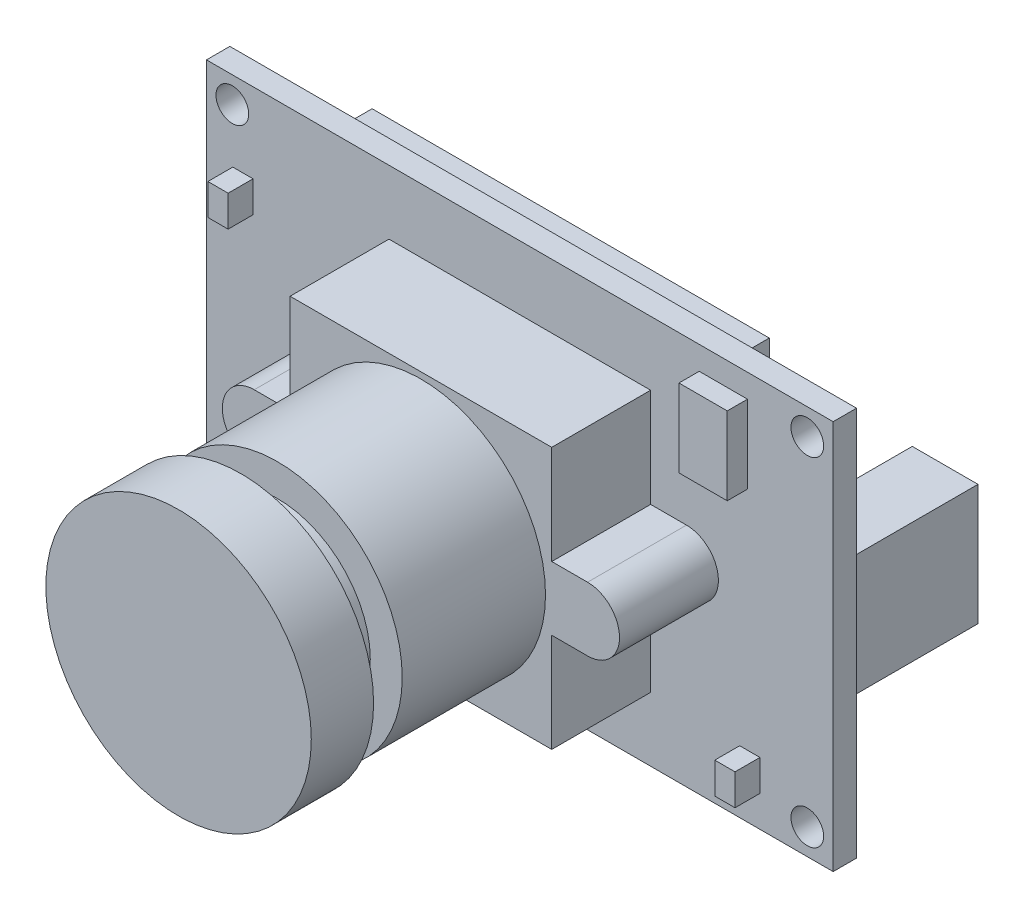
from build123d import *

# Parameters (mm, degrees)
SKETCH2_W            = 40.2336
SKETCH2_H            = 25.019
SKETCH2_R            = 1.05
BOSS_EXTRUDE1_DEPTH  = 1.5
BOSS_EXTRUDE2_DEPTH  = 6.35
SKETCH4_R            = 8
BOSS_EXTRUDE3_DEPTH  = 9.2
SKETCH5_R            = 5.95
BOSS_EXTRUDE4_DEPTH  = 2.36
SKETCH6_R            = 8.5217
LENS_DEPTH           = 4
SKETCH7_W            = 4.22
SKETCH7_H            = 7.75
BOSS_EXTRUDE6_DEPTH  = 8.3
SKETCH8_W            = 9
SKETCH8_H            = 2.985879982
BOSS_EXTRUDE7_DEPTH  = 4.35
SKETCH9_W            = 3.1
SKETCH9_H            = 5
BOSS_EXTRUDE8_DEPTH  = 1.3
SKETCH10_W           = 25.5
SKETCH10_H           = 8
BOSS_EXTRUDE9_DEPTH  = 1.4
SKETCH11_W           = 1.3
SKETCH11_H           = 2
BOSS_EXTRUDE10_DEPTH = 1.6
SKETCH12_W           = 3
SKETCH12_H           = 3
BOSS_EXTRUDE11_DEPTH = 1.4
SKETCH13_W           = 3.175
SKETCH13_H           = 2.6162
SKETCH13_W_2         = 8.509
SKETCH13_H_2         = 4.826
BOSS_EXTRUDE12_DEPTH = 2.7432


with BuildPart() as part:
    # Sketch2 → Boss-Extrude1 (new body)
    with BuildSketch(Plane.XY):
        Rectangle(SKETCH2_W, SKETCH2_H)
        with Locations((-18.4568, 10.8495)):
            Circle(SKETCH2_R, mode=Mode.SUBTRACT)
        with Locations((-18.4568, -10.8495)):
            Circle(SKETCH2_R, mode=Mode.SUBTRACT)
        with Locations((18.4568, -10.8495)):
            Circle(SKETCH2_R, mode=Mode.SUBTRACT)
        with Locations((18.4568, 10.8495)):
            Circle(SKETCH2_R, mode=Mode.SUBTRACT)
    extrude(amount=BOSS_EXTRUDE1_DEPTH)

    # Sketch3 → Boss-Extrude2 (add)
    with BuildSketch(Plane.XY.offset(1.5)):
        with BuildLine():
            Line((-8.4, -2.05), (-8.4, -8.4))
            Line((-8.4, -8.4), (8.4, -8.4))
            Line((8.4, -8.4), (8.4, -2.05))
            Line((8.4, -2.05), (10.7, -2.05))
            ThreePointArc((10.7, -2.05), (12.75, 0), (10.7, 2.05))
            Line((10.7, 2.05), (8.4, 2.05))
            Line((8.4, 2.05), (8.4, 8.4))
            Line((8.4, 8.4), (-8.4, 8.4))
            Line((-8.4, 8.4), (-8.4, 2.05))
            Line((-8.4, 2.05), (-10.7, 2.05))
            ThreePointArc((-10.7, 2.05), (-12.75, 0), (-10.7, -2.05))
            Line((-10.7, -2.05), (-8.4, -2.05))
        make_face()
    extrude(amount=BOSS_EXTRUDE2_DEPTH)

    # Sketch4 → Boss-Extrude3 (add)
    with BuildSketch(Plane.XY.offset(7.85)):
        Circle(SKETCH4_R)
    extrude(amount=BOSS_EXTRUDE3_DEPTH)

    # Sketch5 → Boss-Extrude4 (add)
    with BuildSketch(Plane.XY.offset(17.05)):
        Circle(SKETCH5_R)
    extrude(amount=BOSS_EXTRUDE4_DEPTH)

    # Sketch6 → Lens (add)
    with BuildSketch(Plane.XY.offset(19.41)):
        Circle(SKETCH6_R)
    extrude(amount=LENS_DEPTH)

    # Sketch7 → Boss-Extrude6 (add)
    with BuildSketch(Plane(origin=(0, 0, 0), x_dir=(-1, 0, 0), z_dir=(0, 0, -1))):
        with Locations((-17.5068, 0)):
            Rectangle(SKETCH7_W, SKETCH7_H)
    extrude(amount=BOSS_EXTRUDE6_DEPTH)

    # Sketch8 → Boss-Extrude7 (add)
    with BuildSketch(Plane(origin=(0, 0, 0), x_dir=(-1, 0, 0), z_dir=(0, 0, -1))):
        with Locations((11.1768, -9.441760009)):
            Rectangle(SKETCH8_W, SKETCH8_H)
    extrude(amount=BOSS_EXTRUDE7_DEPTH)

    # Sketch9 → Boss-Extrude8 (add)
    with BuildSketch(Plane.XY.offset(1.5)):
        with Locations((13.0668, 8.5095)):
            Rectangle(SKETCH9_W, SKETCH9_H)
    extrude(amount=BOSS_EXTRUDE8_DEPTH)

    # Sketch10 → Boss-Extrude9 (add)
    with BuildSketch(Plane(origin=(0, 0, 0), x_dir=(-1, 0, 0), z_dir=(0, 0, -1))):
        with Locations((-0.3668, 8.2095)):
            Rectangle(SKETCH10_W, SKETCH10_H)
    extrude(amount=BOSS_EXTRUDE9_DEPTH)

    # Sketch11 → Boss-Extrude10 (add)
    with BuildSketch(Plane.XY.offset(1.5)):
        with Locations((14.7668, -9.5095)):
            Rectangle(SKETCH11_W, SKETCH11_H)
        with Locations((-17.777092667, 6.391636208)):
            Rectangle(SKETCH11_W, SKETCH11_H)
    extrude(amount=BOSS_EXTRUDE10_DEPTH)

    # Sketch12 → Boss-Extrude11 (add)
    with BuildSketch(Plane(origin=(0, 0, 0), x_dir=(-1, 0, 0), z_dir=(0, 0, -1))):
        with Locations((17.6168, 6.6095)):
            Rectangle(SKETCH12_W, SKETCH12_H)
    extrude(amount=BOSS_EXTRUDE11_DEPTH)

    # Sketch13 → Boss-Extrude12 (add)
    with BuildSketch(Plane(origin=(0, 0, 0), x_dir=(-1, 0, 0), z_dir=(0, 0, -1))):
        with Locations((-12.5603, -10.6934)):
            Rectangle(SKETCH13_W, SKETCH13_H)
        with Locations((-2.9083, -9.5885)):
            Rectangle(SKETCH13_W_2, SKETCH13_H_2)
    extrude(amount=BOSS_EXTRUDE12_DEPTH)


solid = part.part
